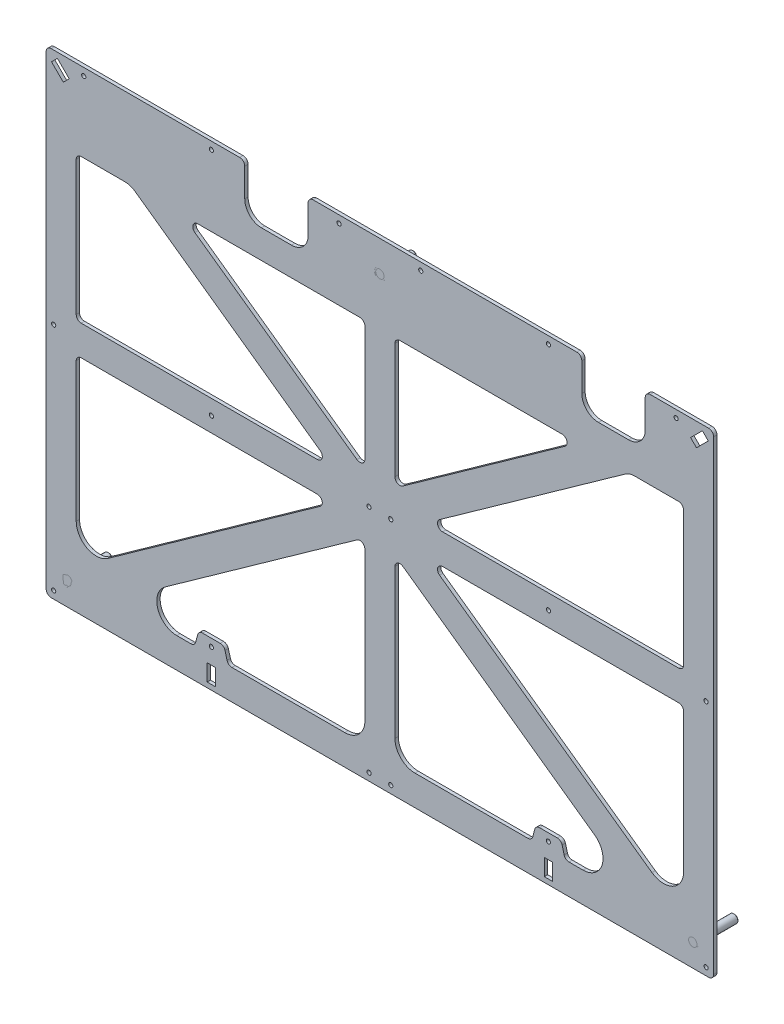
from build123d import *

# Parameters (mm, degrees)
CROQUIS1_W                      = 5
CROQUIS1_H                      = 10
SALIENTE_EXTRUIR1_DEPTH         = 2
CORTAR_EXTRUIR1_DEPTH           = 3
REDONDEO4_R                     = 12
CORTAR_EXTRUIR2_REACH           = 496.414
CROQUIS5_R                      = 2.5
REDONDEO_R                      = 12
SALIENTE_EXTRUIR6_DEPTH         = 2
REDONDEO3_R                     = 3
REDONDEO5_R                     = 12
S_LIDO_MOVER_COPIAR2_ANGLE      = 90
A3FH_M5_25_2_ANGLE              = 90
S_LIDO_MOVER_COPIAR4_ANGLE      = 90
CROQUIS11_W                     = 45
CROQUIS11_H                     = 47
SALIENTE_EXTRUIR2_DEPTH         = 2
CROQUIS12_W                     = 38
CROQUIS12_H                     = 30
CORTAR_EXTRUIR3_DEPTH           = 495.944441324
SALIENTE_EXTRUIR8_DEPTH         = 2
REDONDEO8_R                     = 10
REDONDEO9_R                     = 3
S_LIDO_MOVER_COPIAR8_ANGLE      = 90
REDONDEO10_R                    = 3
REDONDEO11_R                    = 10
CROQUIS31_R                     = 1
CORTAR_EXTRUIR4_DEPTH           = 2
CROQUIS38_W                     = 1.25
CROQUIS38_H                     = 25
TALADRO_ROSCADO_M34_AT_2_COUNT  = 2
TALADRO_ROSCADO_M34_AT_2_PITCH  = 96.199012469
TALADRO_ROSCADO_M34_AT_3_COUNT  = 2
TALADRO_ROSCADO_M34_AT_3_PITCH  = 189
TALADRO_ROSCADO_M34_AT_4_COUNT  = 2
TALADRO_ROSCADO_M34_AT_4_PITCH  = 202
TALADRO_ROSCADO_M34_AT_5_COUNT  = 2
TALADRO_ROSCADO_M34_AT_5_PITCH  = 297.045871878
TALADRO_ROSCADO_M34_AT_6_COUNT  = 2
TALADRO_ROSCADO_M34_AT_6_PITCH  = 391
TALADRO_ROSCADO_M34_AT_7_COUNT  = 2
TALADRO_ROSCADO_M34_AT_7_PITCH  = 138
TALADRO_ROSCADO_M34_AT_8_COUNT  = 2
TALADRO_ROSCADO_M34_AT_8_PITCH  = 167.255044767
TALADRO_ROSCADO_M34_AT_9_COUNT  = 2
TALADRO_ROSCADO_M34_AT_9_PITCH  = 234.019229979
TALADRO_ROSCADO_M34_AT_10_COUNT = 2
TALADRO_ROSCADO_M34_AT_10_PITCH = 244.638508825
TALADRO_ROSCADO_M34_AT_11_COUNT = 2
TALADRO_ROSCADO_M34_AT_11_PITCH = 327.041664012
TALADRO_ROSCADO_M34_AT_12_COUNT = 2
TALADRO_ROSCADO_M34_AT_12_PITCH = 414.638396678
TALADRO_ROSCADO_M34_AT_13_COUNT = 2
TALADRO_ROSCADO_M34_AT_13_PITCH = 464.009698175
TALADRO_ROSCADO_M34_AT_14_COUNT = 2
TALADRO_ROSCADO_M34_AT_14_PITCH = 405.078078893
TALADRO_ROSCADO_M34_AT_15_COUNT = 2
TALADRO_ROSCADO_M34_AT_15_PITCH = 352.953254695
TALADRO_ROSCADO_M34_AT_16_COUNT = 2
TALADRO_ROSCADO_M34_AT_16_PITCH = 324.679842306
TALADRO_ROSCADO_M34_AT_17_COUNT = 2
TALADRO_ROSCADO_M34_AT_17_PITCH = 291.729755082
TALADRO_ROSCADO_M34_AT_18_COUNT = 2
TALADRO_ROSCADO_M34_AT_18_PITCH = 276.586333719


with BuildPart() as part:
    # Croquis1 → Saliente-Extruir1 (new body)
    with BuildSketch(Plane.XY):
        Polygon((4, 0), (404, 0), (404, 285), (270, 285), (214.5, 285), (4, 285), align=None)
        Polygon((397.267766953, 281.803300859), (390.196699141, 274.732233047), (393.732233047, 271.196699141), (400.803300859, 278.267766953), align=None, mode=Mode.SUBTRACT)
        Polygon((17.803300859, 274.732233047), (14.267766953, 271.196699141), (7.196699141, 278.267766953), (10.732233047, 281.803300859), align=None, mode=Mode.SUBTRACT)
        with Locations((103, 8)):
            Rectangle(CROQUIS1_W, CROQUIS1_H, mode=Mode.SUBTRACT)
        with Locations((305, 8)):
            Rectangle(CROQUIS1_W, CROQUIS1_H, mode=Mode.SUBTRACT)
    extrude(amount=SALIENTE_EXTRUIR1_DEPTH)

    # Croquis3 → Cortar-Extruir1 (cut)
    with BuildSketch(Plane.XY.offset(2)):
        Polygon((22, 261.124201104), (22, 151.5), (175.858527865, 151.5), align=None)
        Polygon((44.773051083, 267), (195, 159.963298896), (195, 267), align=None)
        Polygon((386, 151.5), (232.141472135, 151.5), (386, 261.124201104), align=None)
        Polygon((213, 159.963298896), (213, 267), (363.226948917, 267), align=None)
        Polygon((386, 23.875798896), (386, 133.5), (232.141472135, 133.5), align=None)
        Polygon((195, 18), (44.773051083, 18), (195, 125.036701104), align=None)
        Polygon((213, 18), (363.226948917, 18), (213, 125.036701104), align=None)
        Polygon((175.858527865, 133.5), (22, 23.875798896), (22, 133.5), align=None)
    extrude(amount=-CORTAR_EXTRUIR1_DEPTH, mode=Mode.SUBTRACT)

    # Redondeo4
    redondeo4_edges = [part.edges().sort_by_distance(p)[0] for p in [
        (44.773051083, 18, 1),
        (363.226948917, 18, 1),
    ]]
    fillet(redondeo4_edges, radius=REDONDEO4_R)

    # Croquis5 → Cortar-Extruir2 (cut, up to next)
    with BuildSketch(Plane.XY.offset(2), mode=Mode.PRIVATE) as cortar_extruir2_sk1:
        with Locations((204, 266.5)):
            Circle(CROQUIS5_R)
    cortar_extruir2_tool1 = extrude(cortar_extruir2_sk1.sketch, amount=-CORTAR_EXTRUIR2_REACH, mode=Mode.PRIVATE) & part.part
    # Croquis5 → Cortar-Extruir2 (cut, up to next)
    with BuildSketch(Plane.XY.offset(2), mode=Mode.PRIVATE) as cortar_extruir2_sk2:
        with Locations((16.5, 13.5)):
            Circle(CROQUIS5_R)
    cortar_extruir2_tool2 = extrude(cortar_extruir2_sk2.sketch, amount=-CORTAR_EXTRUIR2_REACH, mode=Mode.PRIVATE) & part.part
    # Croquis5 → Cortar-Extruir2 (cut, up to next)
    with BuildSketch(Plane.XY.offset(2), mode=Mode.PRIVATE) as cortar_extruir2_sk3:
        with Locations((391.5, 13.5)):
            Circle(CROQUIS5_R)
    cortar_extruir2_tool3 = extrude(cortar_extruir2_sk3.sketch, amount=-CORTAR_EXTRUIR2_REACH, mode=Mode.PRIVATE) & part.part
    add(cortar_extruir2_tool1.solids().sort_by_distance((204, 266.5, 2))[0], mode=Mode.SUBTRACT)
    add(cortar_extruir2_tool2.solids().sort_by_distance((16.5, 13.5, 2))[0], mode=Mode.SUBTRACT)
    add(cortar_extruir2_tool3.solids().sort_by_distance((391.5, 13.5, 2))[0], mode=Mode.SUBTRACT)

    # Redondeo
    redondeo_edges = [part.edges().sort_by_distance(p)[0] for p in [
        (386, 23.875798896, 1),
        (22, 23.875798896, 1),
    ]]
    fillet(redondeo_edges, radius=REDONDEO_R)

    # Croquis18 → Saliente-Extruir6 (add)
    with BuildSketch(Plane.XY.offset(2)):
        Polygon((110.588457268, 27), (95.411542732, 27), (93, 18), (113, 18), align=None)
        Polygon((315, 18), (295, 18), (297.411542732, 27), (312.588457268, 27), align=None)
    extrude(amount=-SALIENTE_EXTRUIR6_DEPTH)

    # Redondeo3
    redondeo3_edges = [part.edges().sort_by_distance(p)[0] for p in [
        (4, 285, 1),
        (404, 285, 1),
        (404, 0, 1),
        (386, 261.124201104, 1),
        (386, 151.5, 1),
        (232.141472135, 151.5, 1),
        (4, 0, 1),
        (363.226948917, 267, 1),
        (213, 159.963298896, 1),
        (213, 267, 1),
        (232.141472135, 133.5, 1),
        (386, 133.5, 1),
        (195, 125.036701104, 1),
        (213, 125.036701104, 1),
        (22, 133.5, 1),
        (175.858527865, 133.5, 1),
        (93, 18, 1),
        (113, 18, 1),
        (110.588457268, 27, 1),
        (95.411542732, 27, 1),
        (315, 18, 1),
        (295, 18, 1),
        (297.411542732, 27, 1),
        (312.588457268, 27, 1),
        (22, 261.124201104, 1),
        (175.858527865, 151.5, 1),
        (22, 151.5, 1),
        (44.773051083, 267, 1),
        (195, 267, 1),
        (195, 159.963298896, 1),
    ]]
    fillet(redondeo3_edges, radius=REDONDEO3_R)

    # Redondeo5
    redondeo5_edges = [part.edges().sort_by_distance(p)[0] for p in [
        (195, 18, 1),
        (213, 18, 1),
    ]]
    fillet(redondeo5_edges, radius=REDONDEO5_R)

    # Croquis11 → Saliente-Extruir2 (add)
    with BuildSketch(Plane(origin=(0, 0, 0), x_dir=(-1, 0, 0), z_dir=(0, 0, -1))):
        with Locations((-344, 261.5)):
            Rectangle(CROQUIS11_W, CROQUIS11_H)
        with Locations((-142, 261.5)):
            Rectangle(CROQUIS11_W, CROQUIS11_H)
    extrude(amount=-SALIENTE_EXTRUIR2_DEPTH)

    # Croquis12 → Cortar-Extruir3 (cut, through all)
    with BuildSketch(Plane(origin=(0, 0, 0), x_dir=(-1, 0, 0), z_dir=(0, 0, -1))):
        with Locations((-344, 270)):
            Rectangle(CROQUIS12_W, CROQUIS12_H)
        with Locations((-142, 270)):
            Rectangle(CROQUIS12_W, CROQUIS12_H)
    extrude(amount=-CORTAR_EXTRUIR3_DEPTH, mode=Mode.SUBTRACT)

    # Croquis21 → Saliente-Extruir8 (add, through all)
    with BuildSketch(Plane(origin=(0, 0, 0), x_dir=(-1, 0, 0), z_dir=(0, 0, -1))):
        with BuildLine():
            Line((-22, 238), (-22, 255.303101471))
            ThreePointArc((-22, 255.303101471), (-23.625677094, 257.969791658), (-26.740824368, 257.746363742))
            Line((-26.740824368, 257.746363742), (-54.455019093, 238))
            Line((-54.455019093, 238), (-22, 238))
        make_face()
        with BuildLine():
            Line((-85.474805469, 238), (-52.412717427, 261.55673773))
            ThreePointArc((-52.412717427, 261.55673773), (-51.296114034, 264.913841668), (-54.153541795, 267))
            Line((-54.153541795, 267), (-119.5, 267))
            Line((-119.5, 267), (-119.5, 238))
            Line((-119.5, 238), (-85.474805469, 238))
        make_face()
        with BuildLine():
            Line((-164.5, 267), (-192, 267))
            ThreePointArc((-192, 267), (-194.121320344, 266.121320344), (-195, 264))
            Line((-195, 264), (-195, 238))
            Line((-195, 238), (-164.5, 238))
            Line((-164.5, 238), (-164.5, 267))
        make_face()
        with BuildLine():
            Line((-213, 238), (-213, 264))
            ThreePointArc((-213, 264), (-213.878679656, 266.121320344), (-216, 267))
            Line((-216, 267), (-321.5, 267))
            Line((-321.5, 267), (-321.5, 238))
            Line((-321.5, 238), (-213, 238))
        make_face()
        with BuildLine():
            Line((-366.5, 247.230451104), (-381.259175632, 257.746363742))
            ThreePointArc((-381.259175632, 257.746363742), (-384.374322906, 257.969791658), (-386, 255.303101471))
            Line((-386, 255.303101471), (-386, 238))
            Line((-386, 238), (-366.5, 238))
            Line((-366.5, 238), (-366.5, 247.230451104))
        make_face()
    extrude(amount=-SALIENTE_EXTRUIR8_DEPTH)

    # Redondeo8
    redondeo8_edges = [part.edges().sort_by_distance(p)[0] for p in [
        (325, 255, 1),
        (363, 255, 1),
        (161, 255, 1),
        (123, 255, 1),
    ]]
    fillet(redondeo8_edges, radius=REDONDEO8_R)

    # Redondeo9
    redondeo9_edges = [part.edges().sort_by_distance(p)[0] for p in [
        (325, 285, 1),
        (363, 285, 1),
        (161, 285, 1),
        (123, 285, 1),
    ]]
    fillet(redondeo9_edges, radius=REDONDEO9_R)

    # Redondeo10
    redondeo10_edges = [part.edges().sort_by_distance(p)[0] for p in [
        (322.525194531, 238, 1),
        (22, 238, 1),
        (85.474805469, 238, 1),
        (195, 238, 1),
        (213, 238, 1),
        (386, 238, 1),
    ]]
    fillet(redondeo10_edges, radius=REDONDEO10_R)

    # Redondeo11
    redondeo11_edges = [part.edges().sort_by_distance(p)[0] for p in [
        (353.544980907, 238, 1),
        (54.455019093, 238, 1),
    ]]
    fillet(redondeo11_edges, radius=REDONDEO11_R)

    # Croquis31 → Cortar-Extruir4 (cut)
    with BuildSketch(Plane.XY.offset(2)):
        with Locations((26.5, 280.5)):
            Circle(CROQUIS31_R)
        with Locations((8.5, 142.5)):
            Circle(CROQUIS31_R)
        with Locations((8.5, 4.5)):
            Circle(CROQUIS31_R)
        with Locations((103, 22.5)):
            Circle(CROQUIS31_R)
        with Locations((103, 142.5)):
            Circle(CROQUIS31_R)
        with Locations((103, 280.5)):
            Circle(CROQUIS31_R)
        with Locations((179.5, 280.5)):
            Circle(CROQUIS31_R)
        with Locations((228.5, 280.5)):
            Circle(CROQUIS31_R)
        with Locations((305, 280.5)):
            Circle(CROQUIS31_R)
        with Locations((381.5, 280.5)):
            Circle(CROQUIS31_R)
        with Locations((197.5, 142.5)):
            Circle(CROQUIS31_R)
        with Locations((210.5, 142.5)):
            Circle(CROQUIS31_R)
        with Locations((197.5, 4.5)):
            Circle(CROQUIS31_R)
        with Locations((210.5, 4.5)):
            Circle(CROQUIS31_R)
        with Locations((305, 22.5)):
            Circle(CROQUIS31_R)
        with Locations((305, 142.5)):
            Circle(CROQUIS31_R)
        with Locations((399.5, 142.5)):
            Circle(CROQUIS31_R)
        with Locations((399.5, 4.5)):
            Circle(CROQUIS31_R)
    extrude(amount=-CORTAR_EXTRUIR4_DEPTH, mode=Mode.SUBTRACT)

    # Croquis38 → Taladro roscado M34 (revolve, cut)
    with BuildSketch(Plane(origin=(8.5, 4.5, 2), x_dir=(0, -1, 0), z_dir=(1, 0, 0))):
        with Locations((0.625, 12.5)):
            Rectangle(CROQUIS38_W, CROQUIS38_H)
    taladro_roscado_m34 = revolve(axis=Axis((8.5, 4.5, 8.35), (0, 0, -1)), mode=Mode.SUBTRACT)

    # Taladro roscado M34 at 2: Taladro roscado M34 ×2
    with Locations(*[Vector(0.982338566422474, 0.18711210788999905, 0) * (i * TALADRO_ROSCADO_M34_AT_2_PITCH) for i in range(1, TALADRO_ROSCADO_M34_AT_2_COUNT)]):
        add(taladro_roscado_m34, mode=Mode.SUBTRACT)

    # Taladro roscado M34 at 3: Taladro roscado M34 ×2
    with Locations(*[(i * TALADRO_ROSCADO_M34_AT_3_PITCH, 0, 0) for i in range(1, TALADRO_ROSCADO_M34_AT_3_COUNT)]):
        add(taladro_roscado_m34, mode=Mode.SUBTRACT)

    # Taladro roscado M34 at 4: Taladro roscado M34 ×2
    with Locations(*[(i * TALADRO_ROSCADO_M34_AT_4_PITCH, 0, 0) for i in range(1, TALADRO_ROSCADO_M34_AT_4_COUNT)]):
        add(taladro_roscado_m34, mode=Mode.SUBTRACT)

    # Taladro roscado M34 at 5: Taladro roscado M34 ×2
    with Locations(*[Vector(0.9981623313768002, 0.06059670139892982, 0) * (i * TALADRO_ROSCADO_M34_AT_5_PITCH) for i in range(1, TALADRO_ROSCADO_M34_AT_5_COUNT)]):
        add(taladro_roscado_m34, mode=Mode.SUBTRACT)

    # Taladro roscado M34 at 6: Taladro roscado M34 ×2
    with Locations(*[(i * TALADRO_ROSCADO_M34_AT_6_PITCH, 0, 0) for i in range(1, TALADRO_ROSCADO_M34_AT_6_COUNT)]):
        add(taladro_roscado_m34, mode=Mode.SUBTRACT)

    # Taladro roscado M34 at 7: Taladro roscado M34 ×2
    with Locations(*[(0, i * TALADRO_ROSCADO_M34_AT_7_PITCH, 0) for i in range(1, TALADRO_ROSCADO_M34_AT_7_COUNT)]):
        add(taladro_roscado_m34, mode=Mode.SUBTRACT)

    # Taladro roscado M34 at 8: Taladro roscado M34 ×2
    with Locations(*[Vector(0.5650053792497846, 0.8250872204917533, 0) * (i * TALADRO_ROSCADO_M34_AT_8_PITCH) for i in range(1, TALADRO_ROSCADO_M34_AT_8_COUNT)]):
        add(taladro_roscado_m34, mode=Mode.SUBTRACT)

    # Taladro roscado M34 at 9: Taladro roscado M34 ×2
    with Locations(*[Vector(0.807625937479147, 0.5896951289530287, 0) * (i * TALADRO_ROSCADO_M34_AT_9_PITCH) for i in range(1, TALADRO_ROSCADO_M34_AT_9_COUNT)]):
        add(taladro_roscado_m34, mode=Mode.SUBTRACT)

    # Taladro roscado M34 at 10: Taladro roscado M34 ×2
    with Locations(*[Vector(0.8257081069141943, 0.564097617594843, 0) * (i * TALADRO_ROSCADO_M34_AT_10_PITCH) for i in range(1, TALADRO_ROSCADO_M34_AT_10_COUNT)]):
        add(taladro_roscado_m34, mode=Mode.SUBTRACT)

    # Taladro roscado M34 at 11: Taladro roscado M34 ×2
    with Locations(*[Vector(0.9066123146583469, 0.4219645849000063, 0) * (i * TALADRO_ROSCADO_M34_AT_11_PITCH) for i in range(1, TALADRO_ROSCADO_M34_AT_11_COUNT)]):
        add(taladro_roscado_m34, mode=Mode.SUBTRACT)

    # Taladro roscado M34 at 12: Taladro roscado M34 ×2
    with Locations(*[Vector(0.9429903335828896, 0.3328201177351371, 0) * (i * TALADRO_ROSCADO_M34_AT_12_PITCH) for i in range(1, TALADRO_ROSCADO_M34_AT_12_COUNT)]):
        add(taladro_roscado_m34, mode=Mode.SUBTRACT)

    # Taladro roscado M34 at 13: Taladro roscado M34 ×2
    with Locations(*[Vector(0.8038625086230808, 0.5948151538336992, 0) * (i * TALADRO_ROSCADO_M34_AT_13_PITCH) for i in range(1, TALADRO_ROSCADO_M34_AT_13_COUNT)]):
        add(taladro_roscado_m34, mode=Mode.SUBTRACT)

    # Taladro roscado M34 at 14: Taladro roscado M34 ×2
    with Locations(*[Vector(0.7319576532256583, 0.6813501257682332, 0) * (i * TALADRO_ROSCADO_M34_AT_14_PITCH) for i in range(1, TALADRO_ROSCADO_M34_AT_14_COUNT)]):
        add(taladro_roscado_m34, mode=Mode.SUBTRACT)

    # Taladro roscado M34 at 15: Taladro roscado M34 ×2
    with Locations(*[Vector(0.623312002576456, 0.7819732395959137, 0) * (i * TALADRO_ROSCADO_M34_AT_15_PITCH) for i in range(1, TALADRO_ROSCADO_M34_AT_15_COUNT)]):
        add(taladro_roscado_m34, mode=Mode.SUBTRACT)

    # Taladro roscado M34 at 16: Taladro roscado M34 ×2
    with Locations(*[Vector(0.5266726717167606, 0.8500681718937191, 0) * (i * TALADRO_ROSCADO_M34_AT_16_PITCH) for i in range(1, TALADRO_ROSCADO_M34_AT_16_COUNT)]):
        add(taladro_roscado_m34, mode=Mode.SUBTRACT)

    # Taladro roscado M34 at 17: Taladro roscado M34 ×2
    with Locations(*[Vector(0.3239299329393069, 0.9460810739814723, 0) * (i * TALADRO_ROSCADO_M34_AT_17_PITCH) for i in range(1, TALADRO_ROSCADO_M34_AT_17_COUNT)]):
        add(taladro_roscado_m34, mode=Mode.SUBTRACT)

    # Taladro roscado M34 at 18: Taladro roscado M34 ×2
    with Locations(*[Vector(0.06507913734559631, 0.9978801059658184, 0) * (i * TALADRO_ROSCADO_M34_AT_18_PITCH) for i in range(1, TALADRO_ROSCADO_M34_AT_18_COUNT)]):
        add(taladro_roscado_m34, mode=Mode.SUBTRACT)


with BuildPart() as body_2:
    # A3FH-M5-25: read off the stored shape, not the designer's step
    # A3FH-M5-25 outline → A3FH-M5-25 (revolve)
    with BuildSketch(Plane(origin=(10.974604963, 0, -46.379859945), x_dir=(1, 0, 0), z_dir=(0, 0, 1))):
        Polygon((0, 150.700967546), (0, 125.700967546), (2, 125.700967546), (2.5, 126.200967546), (2.5, 149.700967546), (3.25, 149.700967546), (3.25, 150.700967546), align=None)
    revolve(axis=Axis((10.974604963, 0, -46.379859945), (0, 1, 0)))


with BuildPart() as body_2_1:
    # Sólido-Mover/Copiar2: read off the stored shape, not the designer's step
    # Sólido-Mover/Copiar2: moved
    add(body_2.part.moved(Location((5.525395, -148.7009675, 32.8798599))).rotate(Axis((0, 0, 0), (1, 0, 0)), S_LIDO_MOVER_COPIAR2_ANGLE))


with BuildPart() as body_3:
    # A3FH-M5-25 2: read off the stored shape, not the designer's step
    # A3FH-M5-25 2: copy of body 2
    add(body_2_1.part.moved(Location((166.3953643, 34.2280334, 119.4541267))).rotate(Axis((0, 0, 0), (-1, 0, 0)), A3FH_M5_25_2_ANGLE))


with BuildPart() as body_3_1:
    # Sólido-Mover/Copiar4: read off the stored shape, not the designer's step
    # Sólido-Mover/Copiar4: moved
    add(body_3.part.moved(Location((208.6046357, -119.4541267, 34.2280334))).rotate(Axis((0, 0, 0), (1, 0, 0)), S_LIDO_MOVER_COPIAR4_ANGLE))


with BuildPart() as body_4:
    # FH-M5-20: read off the stored shape, not the designer's step
    # FH-M5-20 outline → FH-M5-20 (revolve)
    with BuildSketch(Plane.XY):
        Polygon((0, 0), (0, -20), (2, -20), (2.5, -19.5), (2.5, -1), (3.25, -1), (3.25, 0), align=None)
    revolve(axis=Axis((0, 0, 0), (0, 1, 0)))


with BuildPart() as body_4_1:
    # Sólido-Mover/Copiar8: read off the stored shape, not the designer's step
    # Sólido-Mover/Copiar8: moved
    add(body_4.part.moved(Location((204, 2, -266.5))).rotate(Axis((0, 0, 0), (1, 0, 0)), S_LIDO_MOVER_COPIAR8_ANGLE))


solid = Compound([part.part, body_2_1.part, body_3_1.part, body_4_1.part])
